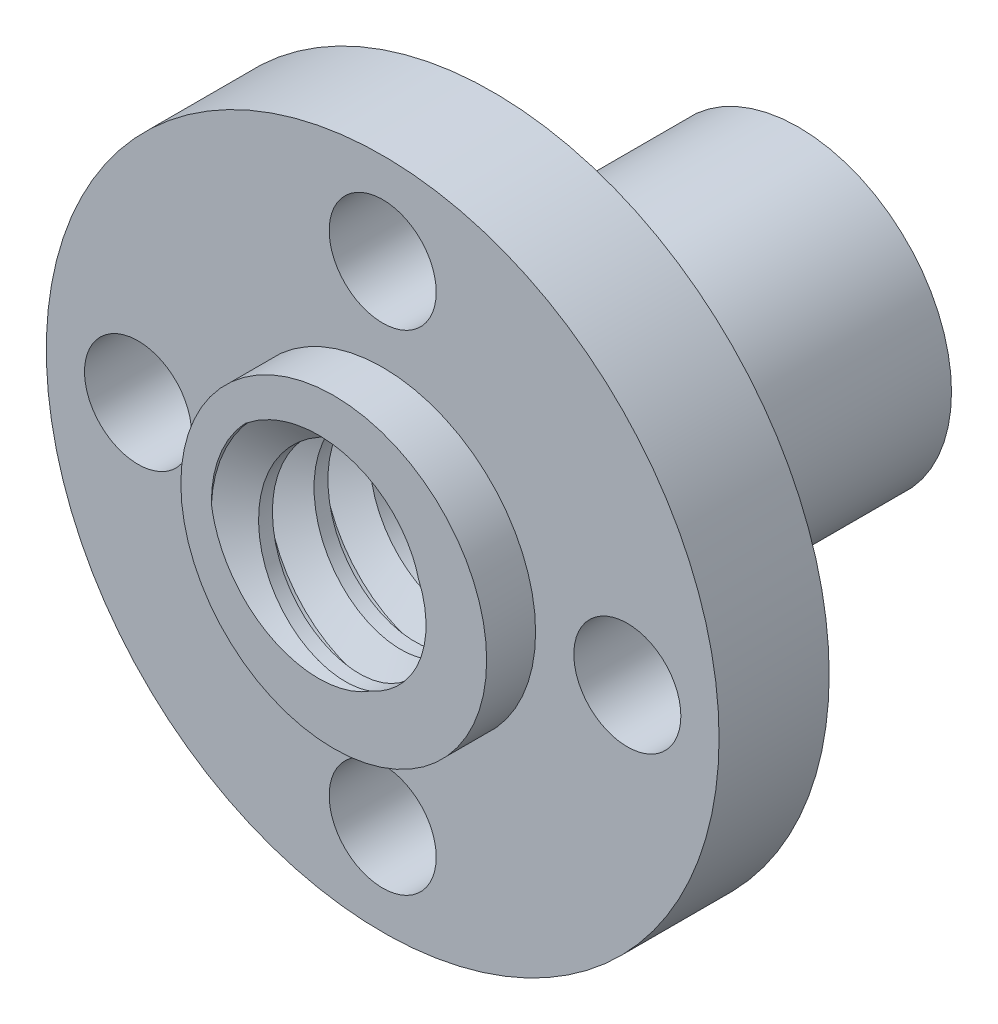
from build123d import *
from build123d.topology import SkipClean

# Parameters (mm, degrees)
SKETCH1_R           = 11
BOSS_EXTRUDE1_DEPTH = 3.6
SKETCH2_R           = 5
BOSS_EXTRUDE2_DEPTH = 1.6
BOSS_EXTRUDE3_START = 10
SKETCH3_R           = 5
BOSS_EXTRUDE3_DEPTH = 10
CUT_EXTRUDE1_REACH  = 23.749
SKETCH4_R           = 4
THREAD1_PITCH       = 1.814286
SKETCH7_R           = 5
CUT_EXTRUDE2_DEPTH  = 2
CUT_EXTRUDE3_REACH  = 22.663
SKETCH8_R           = 1.75


with BuildPart() as part:
    # Sketch1 → Boss-Extrude1 (new body)
    with BuildSketch(Plane.XY):
        Circle(SKETCH1_R)
    extrude(amount=BOSS_EXTRUDE1_DEPTH)

    # Sketch2 → Boss-Extrude2 (add)
    with BuildSketch(Plane.XY.offset(3.6)):
        Circle(SKETCH2_R)
    extrude(amount=BOSS_EXTRUDE2_DEPTH)

    # Sketch3 → Boss-Extrude3 (add)
    with BuildSketch(Plane(origin=(0, 0, 0), x_dir=(-1, 0, 0), z_dir=(0, 0, -1)).offset(BOSS_EXTRUDE3_START)):
        with Locations(Location((0, 0, 0), (0, 0, 180))):
            Circle(SKETCH3_R)
    extrude(amount=-BOSS_EXTRUDE3_DEPTH)

    # Sketch4 → Cut-Extrude1 (cut, up to next)
    with BuildSketch(Plane(origin=(0, 0, -10), x_dir=(-1, 0, 0), z_dir=(0, 0, -1)), mode=Mode.PRIVATE) as cut_extrude1_sk1:
        Circle(SKETCH4_R)
    cut_extrude1_tool1 = extrude(cut_extrude1_sk1.sketch, amount=-CUT_EXTRUDE1_REACH, mode=Mode.PRIVATE) & part.part
    add(cut_extrude1_tool1.solids().sort_by_distance((0, 0, -10))[0], mode=Mode.SUBTRACT)

    # Thread1: the profile of Thread Profile1 profile screwed along a right-hand helix of 8.377953 turns, 10 arcs to a turn; built about Z, then put on its axis
    with SkipClean():  # the faces are left unmerged after this step: merging them gives an invalid solid
        thread1_z = Axis((0, 0, 0), (0, 0, 1))
        thread1_corners = [(4.0003, 0, -0.000173), (4.0003, 0, 1.587673), (3.017989, 0, 1.020536), (3.017989, 0, 0.566964)]
        with BuildLine(mode=Mode.PRIVATE) as thread1_profile:
            Line(thread1_corners[0], thread1_corners[1])
            Line(thread1_corners[1], thread1_corners[2])
            Line(thread1_corners[2], thread1_corners[3])
            Line(thread1_corners[3], thread1_corners[0])
        thread1_cap = Face(thread1_profile.wire())
        thread1_turn_angles = [0, 18, 36, 54, 72, 90, 108, 126, 144, 162, 180, 198, 216, 234, 252, 270, 288, 306, 324, 342, 360]
        thread1_turn_weights = [1, 0.9510565162951535, 1, 0.9510565162951535, 1, 0.9510565162951535, 1, 0.9510565162951535, 1, 0.9510565162951535, 1, 0.9510565162951535, 1, 0.9510565162951535, 1, 0.9510565162951535, 1, 0.9510565162951535, 1, 0.9510565162951535, 1]
        thread1_turn_rails = [Edge.make_bspline([Vector(p[0], p[1], 0).rotate(thread1_z, thread1_turn_angles[k]) / thread1_turn_weights[k] + Vector(0, 0, p[2] + THREAD1_PITCH * thread1_turn_angles[k] / 360) for k in range(21)], [0, 0, 0, 1, 1, 2, 2, 3, 3, 4, 4, 5, 5, 6, 6, 7, 7, 8, 8, 9, 9, 10, 10, 10], 2, thread1_turn_weights) for p in thread1_corners]
        thread1_turn_sides = [Face.make_surface_from_curves(thread1_turn_rails[p[0]], thread1_turn_rails[p[1]]) for p in [(0, 1), (1, 2), (2, 3), (3, 0)]]
        thread1_last_angles = [2880, 2898, 2916, 2934, 2952, 2970, 2988, 3002.031496, 3016.062992]
        thread1_last_weights = [1, 0.9510565162951535, 1, 0.9510565162951535, 1, 0.9510565162951535, 1, 0.9701625927948073, 1]
        thread1_last_rails = [Edge.make_bspline([Vector(p[0], p[1], 0).rotate(thread1_z, thread1_last_angles[k]) / thread1_last_weights[k] + Vector(0, 0, p[2] + THREAD1_PITCH * thread1_last_angles[k] / 360) for k in range(9)], [0, 0, 0, 1, 1, 2, 2, 3, 3, 4, 4, 4], 2, thread1_last_weights) for p in thread1_corners]
        thread1_last_sides = [Face.make_surface_from_curves(thread1_last_rails[p[0]], thread1_last_rails[p[1]]) for p in [(0, 1), (1, 2), (2, 3), (3, 0)]]
        thread1 = Plane(origin=(0, 0, -10), x_dir=(1, 0, 0), z_dir=(0, 0, 1)) * Solid(Shell([*[p.moved(Location((0, 0, THREAD1_PITCH * i))) for i in range(8) for p in thread1_turn_sides], *thread1_last_sides, thread1_cap, thread1_cap.rotate(thread1_z, 3016.062992).moved(Location((0, 0, THREAD1_PITCH * 3016.062992 / 360)))]))
        add(thread1)

    # Sketch7 → Cut-Extrude2 (cut)
    with SkipClean():  # the faces are left unmerged after this step: merging them gives an invalid solid
        with BuildSketch(Plane.XY.offset(5.2)):
            Circle(SKETCH7_R)
        extrude(amount=CUT_EXTRUDE2_DEPTH, mode=Mode.SUBTRACT)

    # Sketch8 → Cut-Extrude3 (cut, up to next)
    with BuildSketch(Plane.XY.offset(3.6), mode=Mode.PRIVATE) as cut_extrude3_sk1:
        with Locations((-8, 0)):
            Circle(SKETCH8_R)
    cut_extrude3_tool1 = extrude(cut_extrude3_sk1.sketch, amount=-CUT_EXTRUDE3_REACH, mode=Mode.PRIVATE) & part.part
    # Sketch8 → Cut-Extrude3 (cut, up to next)
    with BuildSketch(Plane.XY.offset(3.6), mode=Mode.PRIVATE) as cut_extrude3_sk2:
        with Locations((0, 8)):
            Circle(SKETCH8_R)
    cut_extrude3_tool2 = extrude(cut_extrude3_sk2.sketch, amount=-CUT_EXTRUDE3_REACH, mode=Mode.PRIVATE) & part.part
    # Sketch8 → Cut-Extrude3 (cut, up to next)
    with BuildSketch(Plane.XY.offset(3.6), mode=Mode.PRIVATE) as cut_extrude3_sk3:
        with Locations((8, 0)):
            Circle(SKETCH8_R)
    cut_extrude3_tool3 = extrude(cut_extrude3_sk3.sketch, amount=-CUT_EXTRUDE3_REACH, mode=Mode.PRIVATE) & part.part
    # Sketch8 → Cut-Extrude3 (cut, up to next)
    with BuildSketch(Plane.XY.offset(3.6), mode=Mode.PRIVATE) as cut_extrude3_sk4:
        with Locations((0, -8)):
            Circle(SKETCH8_R)
    cut_extrude3_tool4 = extrude(cut_extrude3_sk4.sketch, amount=-CUT_EXTRUDE3_REACH, mode=Mode.PRIVATE) & part.part
    add(cut_extrude3_tool1.solids().sort_by_distance((-8, 0, 3.6))[0], mode=Mode.SUBTRACT)
    add(cut_extrude3_tool2.solids().sort_by_distance((0, 8, 3.6))[0], mode=Mode.SUBTRACT)
    add(cut_extrude3_tool3.solids().sort_by_distance((8, 0, 3.6))[0], mode=Mode.SUBTRACT)
    add(cut_extrude3_tool4.solids().sort_by_distance((0, -8, 3.6))[0], mode=Mode.SUBTRACT)


solid = part.part
